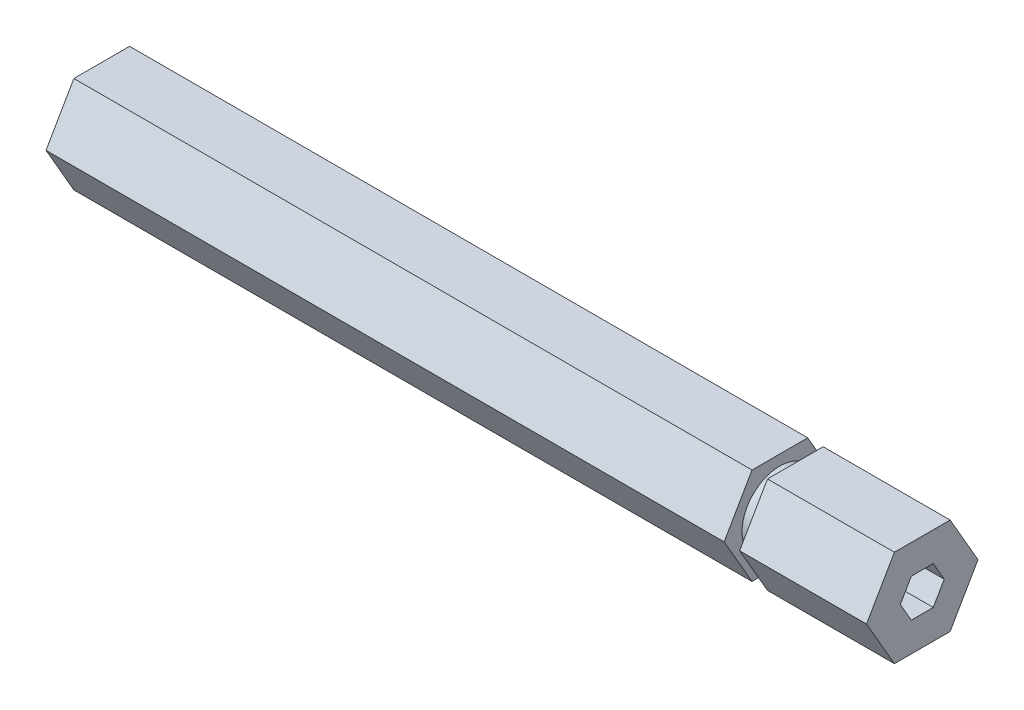
from build123d import *

# Parameters (mm, degrees)
BOSS_EXTRUDE1_DEPTH = 107.95
SKETCH2_W           = 2.032
SKETCH2_H           = 2.353948419


with BuildPart() as part:
    # Sketch1 → Boss-Extrude1 (new body)
    with BuildSketch(Plane(origin=(0, 0, 0), x_dir=(0, 0, -1), z_dir=(1, 0, 0))):
        Polygon((7.332348419, 0), (3.666174209, 6.35), (-3.666174209, 6.35), (-7.332348419, 0), (-3.666174209, -6.35), (3.666174209, -6.35), align=None)
        Polygon((2.886751346, 0), (1.443375673, 2.5), (-1.443375673, 2.5), (-2.886751346, 0), (-1.443375673, -2.5), (1.443375673, -2.5), align=None, mode=Mode.SUBTRACT)
    extrude(amount=BOSS_EXTRUDE1_DEPTH)

    # Sketch2 → Cut-Revolve1 (revolve, cut)
    with BuildSketch(Plane(origin=(0, 0, 0), x_dir=(1, 0, 0), z_dir=(0, 1, 0))):
        with Locations((90.2335, 6.15537421)):
            Rectangle(SKETCH2_W, SKETCH2_H)
    revolve(axis=Axis((0, 0, 0), (1, 0, 0)), mode=Mode.SUBTRACT)


solid = part.part
